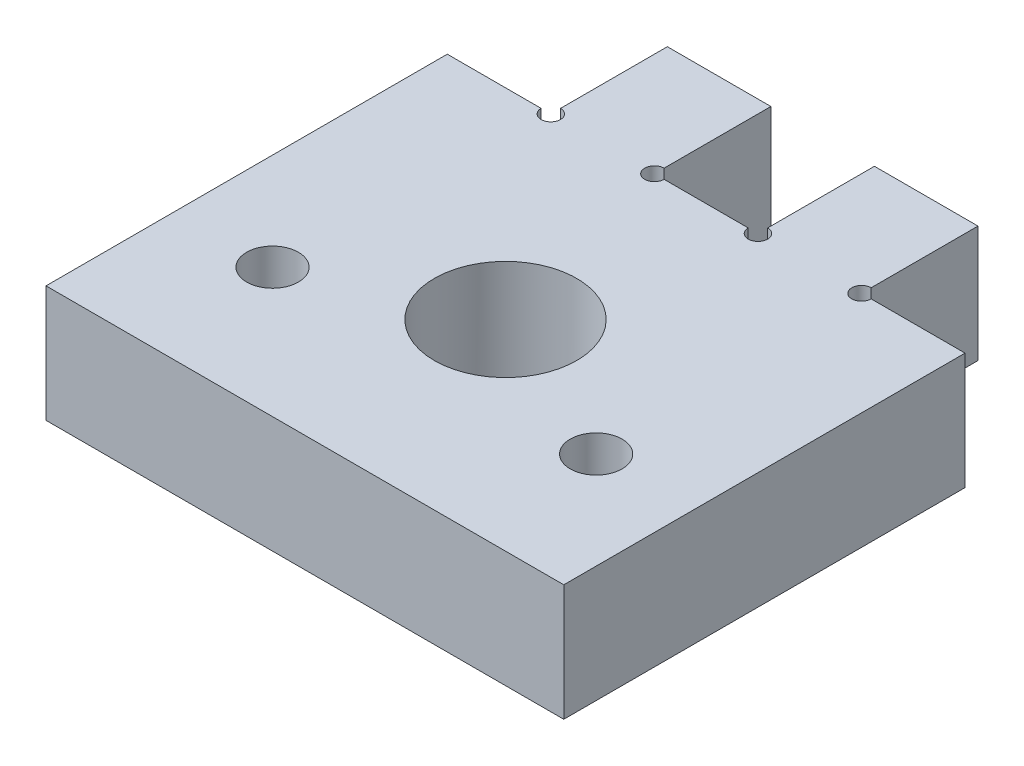
from build123d import *

# Parameters (mm, degrees)
SKETCH1_R           = 4
BOSS_EXTRUDE1_DEPTH = 18
CUT_EXTRUDE1_REACH  = 67.765
SKETCH2_R           = 11
SKETCH3_R           = 1.5
CUT_EXTRUDE2_DEPTH  = 66.76473219


with BuildPart() as part:
    # Sketch1 → Boss-Extrude1 (new body)
    with BuildSketch(Plane(origin=(0, 0, 0), x_dir=(1, 0, 0), z_dir=(0, 1, 0))):
        Polygon((-40, 31), (-24, 31), (-24, 49), (-8, 49), (-8, 31), (8, 31), (8, 49), (24, 49), (24, 31), (40, 31), (40, -31), (-40, -31), align=None)
        Circle(SKETCH1_R, mode=Mode.SUBTRACT)
        with Locations((25, -11)):
            Circle(SKETCH1_R, mode=Mode.SUBTRACT)
        with Locations((-25, -11)):
            Circle(SKETCH1_R, mode=Mode.SUBTRACT)
    extrude(amount=BOSS_EXTRUDE1_DEPTH)

    # Sketch2 → Cut-Extrude1 (cut, up to next)
    with BuildSketch(Plane(origin=(0, 18, 0), x_dir=(1, 0, 0), z_dir=(0, 1, 0)), mode=Mode.PRIVATE) as cut_extrude1_sk1:
        Circle(SKETCH2_R)
    cut_extrude1_tool1 = extrude(cut_extrude1_sk1.sketch, amount=-CUT_EXTRUDE1_REACH, mode=Mode.PRIVATE) & part.part
    add(cut_extrude1_tool1.solids().sort_by_distance((0, 18, 0))[0], mode=Mode.SUBTRACT)

    # Sketch3 → Cut-Extrude2 (cut, through all)
    with BuildSketch(Plane(origin=(0, 18, 0), x_dir=(1, 0, 0), z_dir=(0, 1, 0))):
        with Locations((-24, 31)):
            Circle(SKETCH3_R)
        with Locations((-8, 31)):
            Circle(SKETCH3_R)
        with Locations((8, 31)):
            Circle(SKETCH3_R)
        with Locations((24, 31)):
            Circle(SKETCH3_R)
    extrude(amount=-CUT_EXTRUDE2_DEPTH, mode=Mode.SUBTRACT)


solid = part.part
